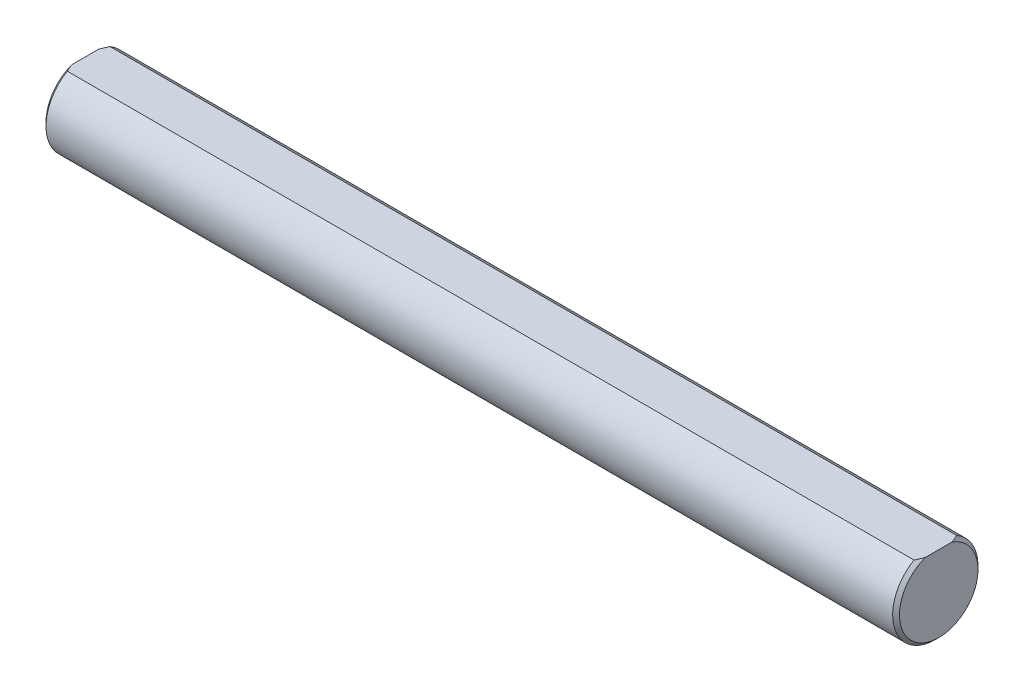
from build123d import *

# Parameters (mm, degrees)
SKETCH1_R           = 3.175
BOSS_EXTRUDE1_DEPTH = 63.5
CHAMFER1_SIZE       = 0.254
CUT_EXTRUDE2_DEPTH  = 64.658552057


with BuildPart() as part:
    # Sketch1 → Boss-Extrude1 (new body)
    with BuildSketch(Plane(origin=(0, 0, 0), x_dir=(0, 0, -1), z_dir=(1, 0, 0))):
        Circle(SKETCH1_R)
    extrude(amount=BOSS_EXTRUDE1_DEPTH)

    # Chamfer1
    chamfer1_edges = [part.edges().sort_by_distance(p)[0] for p in [
        (63.5, 0, 3.175),
        (0, 0, 3.175),
    ]]
    chamfer(chamfer1_edges, length=CHAMFER1_SIZE)

    # Sketch2 → Cut-Extrude2 (cut, through all)
    with BuildSketch(Plane(origin=(63.5, 0, 0), x_dir=(0, 0, -1), z_dir=(1, 0, 0))):
        with BuildLine():
            Line((-1.5875, 2.749630657), (1.5875, 2.749630657))
            ThreePointArc((1.5875, 2.749630657), (0, 3.175), (-1.5875, 2.749630657))
        make_face()
    extrude(amount=-CUT_EXTRUDE2_DEPTH, mode=Mode.SUBTRACT)


solid = part.part
